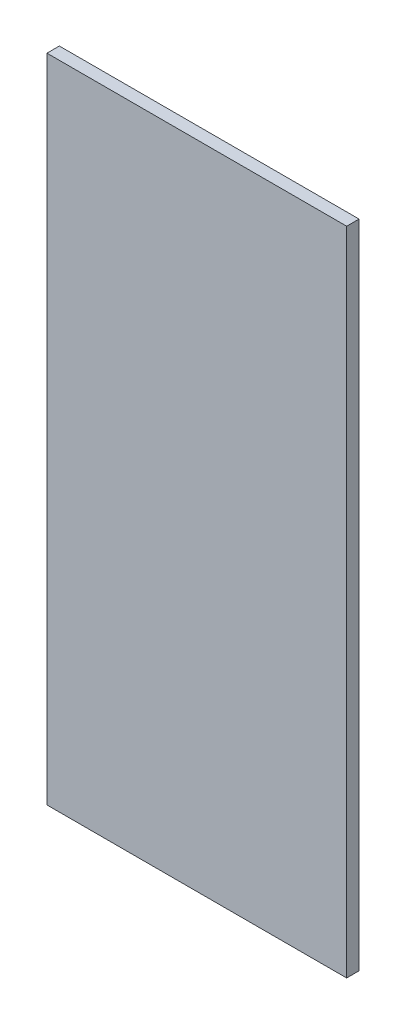
from build123d import *

# Parameters (mm, degrees)
SKETCH1_W           = 145
SKETCH1_H           = 315
BOSS_EXTRUDE1_DEPTH = 6


with BuildPart() as part:
    # Sketch1 → Boss-Extrude1 (new body)
    with BuildSketch(Plane.XY):
        Rectangle(SKETCH1_W, SKETCH1_H)
    extrude(amount=BOSS_EXTRUDE1_DEPTH)


solid = part.part
